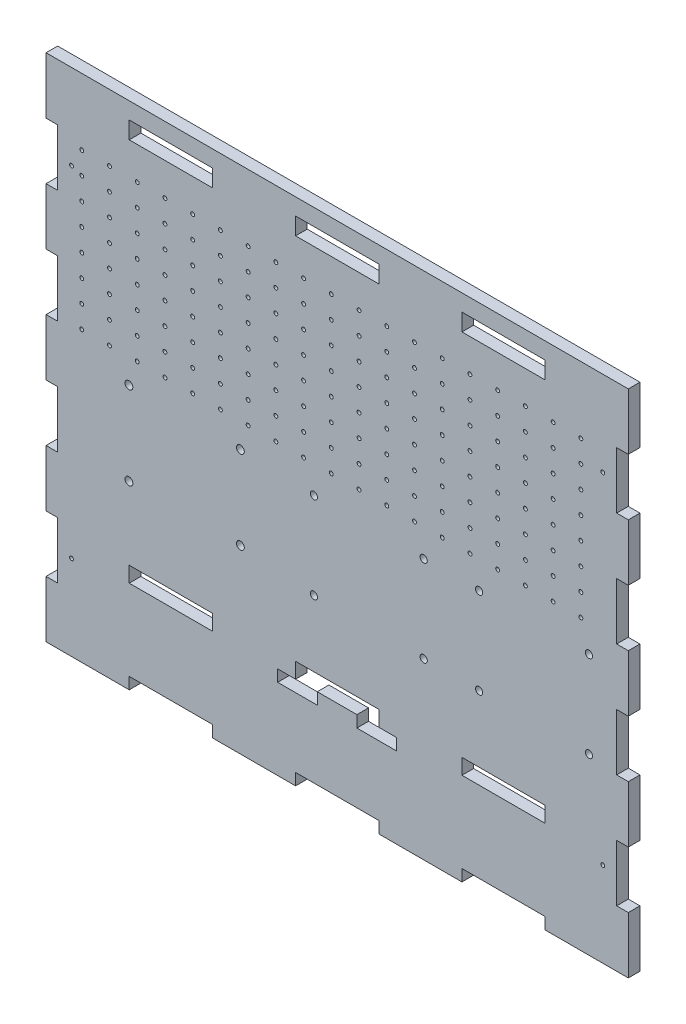
from build123d import *

# Parameters (mm, degrees)
SKETCH1_W                = 266.7
SKETCH1_H                = 223.52
BOSS_EXTRUDE1_DEPTH      = 5.334
SKETCH2_W                = 38.1
SKETCH2_H                = 5.334
CUT_EXTRUDE1_DEPTH       = 197.710659379
SKETCH5_W                = 38.1
SKETCH5_H                = 7.112
CUT_EXTRUDE3_DEPTH       = 197.710659379
SKETCH8_W                = 18.149934459
SKETCH8_H                = 5.334
SKETCH8_W_2              = 18.14993446
CUT_EXTRUDE6_DEPTH       = 197.710659379
SKETCH9_R                = 0.889
CUT_EXTRUDE7_DEPTH       = 197.710659379
SKETCH10_W               = 38.1
SKETCH10_H               = 5.334
BOSS_EXTRUDE2_DEPTH      = 10.16
BOSS_EXTRUDE3_DEPTH      = 76.2
BOSS_EXTRUDE3_DEPTH_BACK = 190.5
SKETCH12_W               = 5.334
SKETCH12_H               = 7.62
SKETCH13_W               = 38.1
SKETCH13_H               = 5.334
BOSS_EXTRUDE4_DEPTH      = 2.54
SKETCH14_W               = 38.1
SKETCH14_H               = 5.334
BOSS_EXTRUDE5_DEPTH      = 2.54
SKETCH15_W               = 38.1
SKETCH15_H               = 5.334
BOSS_EXTRUDE6_DEPTH      = 2.54
SKETCH16_W               = 5.334
SKETCH16_H               = 25.964444445
SKETCH16_H_2             = 25.964444444
CUT_EXTRUDE9_DEPTH       = 205.029793122
SKETCH17_R               = 1.651
CUT_EXTRUDE10_DEPTH      = 205.029793122
SKETCH18_R               = 0.889
CUT_EXTRUDE11_DEPTH      = 205.029793122
SKETCH19_R               = 1.778
CUT_EXTRUDE12_DEPTH      = 205.029793122


with BuildPart() as part:
    # Sketch1 → Boss-Extrude1 (new body)
    with BuildSketch(Plane.XY):
        with Locations((5.474099752, 27.504142138)):
            Rectangle(SKETCH1_W, SKETCH1_H)
    extrude(amount=BOSS_EXTRUDE1_DEPTH)

    # Sketch2 → Cut-Extrude1 (cut, through all)
    with BuildSketch(Plane.XY.offset(5.334)):
        with Locations((-70.725900248, -81.588857862)):
            Rectangle(SKETCH2_W, SKETCH2_H)
        with Locations((5.474099752, -81.588857862)):
            Rectangle(SKETCH2_W, SKETCH2_H)
        with Locations((81.674099752, -81.588857862)):
            Rectangle(SKETCH2_W, SKETCH2_H)
        with Locations((81.674099752, 136.597142138)):
            Rectangle(SKETCH2_W, SKETCH2_H)
        with Locations((5.474099752, 136.597142138)):
            Rectangle(SKETCH2_W, SKETCH2_H)
        with Locations((-70.725900248, 136.597142138)):
            Rectangle(SKETCH2_W, SKETCH2_H)
    extrude(amount=-CUT_EXTRUDE1_DEPTH, mode=Mode.SUBTRACT)

    # Sketch5 → Cut-Extrude3 (cut, through all)
    with BuildSketch(Plane.XY.offset(5.334)):
        with Locations((-70.725900248, -38.378413173)):
            Rectangle(SKETCH5_W, SKETCH5_H)
        with Locations((5.474099752, -38.378413173)):
            Rectangle(SKETCH5_W, SKETCH5_H)
        with Locations((81.674099752, -38.378413173)):
            Rectangle(SKETCH5_W, SKETCH5_H)
    extrude(amount=-CUT_EXTRUDE3_DEPTH, mode=Mode.SUBTRACT)

    # Sketch8 → Cut-Extrude6 (cut, through all)
    with BuildSketch(Plane.XY.offset(5.334)):
        with Locations((-12.722736397, -44.601413173)):
            Rectangle(SKETCH8_W, SKETCH8_H)
        with Locations((23.577132522, -44.601413173)):
            Rectangle(SKETCH8_W_2, SKETCH8_H)
    extrude(amount=-CUT_EXTRUDE6_DEPTH, mode=Mode.SUBTRACT)

    # Sketch9 → Cut-Extrude7 (cut, through all)
    with BuildSketch(Plane.XY.offset(5.334)):
        with Locations((-111.514346632, 118.978930244)):
            Circle(SKETCH9_R)
        with Locations((-98.814346632, 118.978930244)):
            Circle(SKETCH9_R)
        with Locations((-86.114346632, 118.978930244)):
            Circle(SKETCH9_R)
        with Locations((-73.414346632, 118.978930244)):
            Circle(SKETCH9_R)
        with Locations((-60.714346632, 118.978930244)):
            Circle(SKETCH9_R)
        with Locations((-48.014346632, 118.978930244)):
            Circle(SKETCH9_R)
        with Locations((-35.314346632, 118.978930244)):
            Circle(SKETCH9_R)
        with Locations((-22.614346632, 118.978930244)):
            Circle(SKETCH9_R)
        with Locations((-9.914346632, 118.978930244)):
            Circle(SKETCH9_R)
        with Locations((2.785653368, 118.978930244)):
            Circle(SKETCH9_R)
        with Locations((15.485653368, 118.978930244)):
            Circle(SKETCH9_R)
        with Locations((28.185653368, 118.978930244)):
            Circle(SKETCH9_R)
        with Locations((40.885653368, 118.978930244)):
            Circle(SKETCH9_R)
        with Locations((53.585653368, 118.978930244)):
            Circle(SKETCH9_R)
        with Locations((66.285653368, 118.978930244)):
            Circle(SKETCH9_R)
        with Locations((78.985653368, 118.978930244)):
            Circle(SKETCH9_R)
        with Locations((91.685653368, 118.978930244)):
            Circle(SKETCH9_R)
        with Locations((104.385653368, 118.978930244)):
            Circle(SKETCH9_R)
        with Locations((117.085653368, 118.978930244)):
            Circle(SKETCH9_R)
        with Locations((-111.514346632, 108.818930244)):
            Circle(SKETCH9_R)
        with Locations((-98.814346632, 108.818930244)):
            Circle(SKETCH9_R)
        with Locations((-86.114346632, 108.818930244)):
            Circle(SKETCH9_R)
        with Locations((-73.414346632, 108.818930244)):
            Circle(SKETCH9_R)
        with Locations((-60.714346632, 108.818930244)):
            Circle(SKETCH9_R)
        with Locations((-48.014346632, 108.818930244)):
            Circle(SKETCH9_R)
        with Locations((-35.314346632, 108.818930244)):
            Circle(SKETCH9_R)
        with Locations((-22.614346632, 108.818930244)):
            Circle(SKETCH9_R)
        with Locations((-9.914346632, 108.818930244)):
            Circle(SKETCH9_R)
        with Locations((2.785653368, 108.818930244)):
            Circle(SKETCH9_R)
        with Locations((15.485653368, 108.818930244)):
            Circle(SKETCH9_R)
        with Locations((28.185653368, 108.818930244)):
            Circle(SKETCH9_R)
        with Locations((40.885653368, 108.818930244)):
            Circle(SKETCH9_R)
        with Locations((53.585653368, 108.818930244)):
            Circle(SKETCH9_R)
        with Locations((66.285653368, 108.818930244)):
            Circle(SKETCH9_R)
        with Locations((78.985653368, 108.818930244)):
            Circle(SKETCH9_R)
        with Locations((91.685653368, 108.818930244)):
            Circle(SKETCH9_R)
        with Locations((104.385653368, 108.818930244)):
            Circle(SKETCH9_R)
        with Locations((117.085653368, 108.818930244)):
            Circle(SKETCH9_R)
        with Locations((-111.514346632, 98.658930244)):
            Circle(SKETCH9_R)
        with Locations((-98.814346632, 98.658930244)):
            Circle(SKETCH9_R)
        with Locations((-86.114346632, 98.658930244)):
            Circle(SKETCH9_R)
        with Locations((-73.414346632, 98.658930244)):
            Circle(SKETCH9_R)
        with Locations((-60.714346632, 98.658930244)):
            Circle(SKETCH9_R)
        with Locations((-48.014346632, 98.658930244)):
            Circle(SKETCH9_R)
        with Locations((-35.314346632, 98.658930244)):
            Circle(SKETCH9_R)
        with Locations((-22.614346632, 98.658930244)):
            Circle(SKETCH9_R)
        with Locations((-9.914346632, 98.658930244)):
            Circle(SKETCH9_R)
        with Locations((2.785653368, 98.658930244)):
            Circle(SKETCH9_R)
        with Locations((15.485653368, 98.658930244)):
            Circle(SKETCH9_R)
        with Locations((28.185653368, 98.658930244)):
            Circle(SKETCH9_R)
        with Locations((40.885653368, 98.658930244)):
            Circle(SKETCH9_R)
        with Locations((53.585653368, 98.658930244)):
            Circle(SKETCH9_R)
        with Locations((66.285653368, 98.658930244)):
            Circle(SKETCH9_R)
        with Locations((78.985653368, 98.658930244)):
            Circle(SKETCH9_R)
        with Locations((91.685653368, 98.658930244)):
            Circle(SKETCH9_R)
        with Locations((104.385653368, 98.658930244)):
            Circle(SKETCH9_R)
        with Locations((117.085653368, 98.658930244)):
            Circle(SKETCH9_R)
        with Locations((-111.514346632, 88.498930244)):
            Circle(SKETCH9_R)
        with Locations((-98.814346632, 88.498930244)):
            Circle(SKETCH9_R)
        with Locations((-86.114346632, 88.498930244)):
            Circle(SKETCH9_R)
        with Locations((-73.414346632, 88.498930244)):
            Circle(SKETCH9_R)
        with Locations((-60.714346632, 88.498930244)):
            Circle(SKETCH9_R)
        with Locations((-48.014346632, 88.498930244)):
            Circle(SKETCH9_R)
        with Locations((-35.314346632, 88.498930244)):
            Circle(SKETCH9_R)
        with Locations((-22.614346632, 88.498930244)):
            Circle(SKETCH9_R)
        with Locations((-9.914346632, 88.498930244)):
            Circle(SKETCH9_R)
        with Locations((2.785653368, 88.498930244)):
            Circle(SKETCH9_R)
        with Locations((15.485653368, 88.498930244)):
            Circle(SKETCH9_R)
        with Locations((28.185653368, 88.498930244)):
            Circle(SKETCH9_R)
        with Locations((40.885653368, 88.498930244)):
            Circle(SKETCH9_R)
        with Locations((53.585653368, 88.498930244)):
            Circle(SKETCH9_R)
        with Locations((66.285653368, 88.498930244)):
            Circle(SKETCH9_R)
        with Locations((78.985653368, 88.498930244)):
            Circle(SKETCH9_R)
        with Locations((91.685653368, 88.498930244)):
            Circle(SKETCH9_R)
        with Locations((104.385653368, 88.498930244)):
            Circle(SKETCH9_R)
        with Locations((117.085653368, 88.498930244)):
            Circle(SKETCH9_R)
        with Locations((-111.514346632, 78.338930244)):
            Circle(SKETCH9_R)
        with Locations((-98.814346632, 78.338930244)):
            Circle(SKETCH9_R)
        with Locations((-86.114346632, 78.338930244)):
            Circle(SKETCH9_R)
        with Locations((-73.414346632, 78.338930244)):
            Circle(SKETCH9_R)
        with Locations((-60.714346632, 78.338930244)):
            Circle(SKETCH9_R)
        with Locations((-48.014346632, 78.338930244)):
            Circle(SKETCH9_R)
        with Locations((-35.314346632, 78.338930244)):
            Circle(SKETCH9_R)
        with Locations((-22.614346632, 78.338930244)):
            Circle(SKETCH9_R)
        with Locations((-9.914346632, 78.338930244)):
            Circle(SKETCH9_R)
        with Locations((2.785653368, 78.338930244)):
            Circle(SKETCH9_R)
        with Locations((15.485653368, 78.338930244)):
            Circle(SKETCH9_R)
        with Locations((28.185653368, 78.338930244)):
            Circle(SKETCH9_R)
        with Locations((40.885653368, 78.338930244)):
            Circle(SKETCH9_R)
        with Locations((53.585653368, 78.338930244)):
            Circle(SKETCH9_R)
        with Locations((66.285653368, 78.338930244)):
            Circle(SKETCH9_R)
        with Locations((78.985653368, 78.338930244)):
            Circle(SKETCH9_R)
        with Locations((91.685653368, 78.338930244)):
            Circle(SKETCH9_R)
        with Locations((104.385653368, 78.338930244)):
            Circle(SKETCH9_R)
        with Locations((117.085653368, 78.338930244)):
            Circle(SKETCH9_R)
        with Locations((-111.514346632, 68.178930244)):
            Circle(SKETCH9_R)
        with Locations((-98.814346632, 68.178930244)):
            Circle(SKETCH9_R)
        with Locations((-86.114346632, 68.178930244)):
            Circle(SKETCH9_R)
        with Locations((-73.414346632, 68.178930244)):
            Circle(SKETCH9_R)
        with Locations((-60.714346632, 68.178930244)):
            Circle(SKETCH9_R)
        with Locations((-48.014346632, 68.178930244)):
            Circle(SKETCH9_R)
        with Locations((-35.314346632, 68.178930244)):
            Circle(SKETCH9_R)
        with Locations((-22.614346632, 68.178930244)):
            Circle(SKETCH9_R)
        with Locations((-9.914346632, 68.178930244)):
            Circle(SKETCH9_R)
        with Locations((2.785653368, 68.178930244)):
            Circle(SKETCH9_R)
        with Locations((15.485653368, 68.178930244)):
            Circle(SKETCH9_R)
        with Locations((28.185653368, 68.178930244)):
            Circle(SKETCH9_R)
        with Locations((40.885653368, 68.178930244)):
            Circle(SKETCH9_R)
        with Locations((53.585653368, 68.178930244)):
            Circle(SKETCH9_R)
        with Locations((66.285653368, 68.178930244)):
            Circle(SKETCH9_R)
        with Locations((78.985653368, 68.178930244)):
            Circle(SKETCH9_R)
        with Locations((91.685653368, 68.178930244)):
            Circle(SKETCH9_R)
        with Locations((104.385653368, 68.178930244)):
            Circle(SKETCH9_R)
        with Locations((117.085653368, 68.178930244)):
            Circle(SKETCH9_R)
        with Locations((-111.514346632, 58.018930244)):
            Circle(SKETCH9_R)
        with Locations((-98.814346632, 58.018930244)):
            Circle(SKETCH9_R)
        with Locations((-86.114346632, 58.018930244)):
            Circle(SKETCH9_R)
        with Locations((-73.414346632, 58.018930244)):
            Circle(SKETCH9_R)
        with Locations((-60.714346632, 58.018930244)):
            Circle(SKETCH9_R)
        with Locations((-48.014346632, 58.018930244)):
            Circle(SKETCH9_R)
        with Locations((-35.314346632, 58.018930244)):
            Circle(SKETCH9_R)
        with Locations((-22.614346632, 58.018930244)):
            Circle(SKETCH9_R)
        with Locations((-9.914346632, 58.018930244)):
            Circle(SKETCH9_R)
        with Locations((2.785653368, 58.018930244)):
            Circle(SKETCH9_R)
        with Locations((15.485653368, 58.018930244)):
            Circle(SKETCH9_R)
        with Locations((28.185653368, 58.018930244)):
            Circle(SKETCH9_R)
        with Locations((40.885653368, 58.018930244)):
            Circle(SKETCH9_R)
        with Locations((53.585653368, 58.018930244)):
            Circle(SKETCH9_R)
        with Locations((66.285653368, 58.018930244)):
            Circle(SKETCH9_R)
        with Locations((78.985653368, 58.018930244)):
            Circle(SKETCH9_R)
        with Locations((91.685653368, 58.018930244)):
            Circle(SKETCH9_R)
        with Locations((104.385653368, 58.018930244)):
            Circle(SKETCH9_R)
        with Locations((117.085653368, 58.018930244)):
            Circle(SKETCH9_R)
        with Locations((-111.514346632, 47.858930244)):
            Circle(SKETCH9_R)
        with Locations((-98.814346632, 47.858930244)):
            Circle(SKETCH9_R)
        with Locations((-86.114346632, 47.858930244)):
            Circle(SKETCH9_R)
        with Locations((-73.414346632, 47.858930244)):
            Circle(SKETCH9_R)
        with Locations((-60.714346632, 47.858930244)):
            Circle(SKETCH9_R)
        with Locations((-48.014346632, 47.858930244)):
            Circle(SKETCH9_R)
        with Locations((-35.314346632, 47.858930244)):
            Circle(SKETCH9_R)
        with Locations((-22.614346632, 47.858930244)):
            Circle(SKETCH9_R)
        with Locations((-9.914346632, 47.858930244)):
            Circle(SKETCH9_R)
        with Locations((2.785653368, 47.858930244)):
            Circle(SKETCH9_R)
        with Locations((15.485653368, 47.858930244)):
            Circle(SKETCH9_R)
        with Locations((28.185653368, 47.858930244)):
            Circle(SKETCH9_R)
        with Locations((40.885653368, 47.858930244)):
            Circle(SKETCH9_R)
        with Locations((53.585653368, 47.858930244)):
            Circle(SKETCH9_R)
        with Locations((66.285653368, 47.858930244)):
            Circle(SKETCH9_R)
        with Locations((78.985653368, 47.858930244)):
            Circle(SKETCH9_R)
        with Locations((91.685653368, 47.858930244)):
            Circle(SKETCH9_R)
        with Locations((104.385653368, 47.858930244)):
            Circle(SKETCH9_R)
        with Locations((117.085653368, 47.858930244)):
            Circle(SKETCH9_R)
    extrude(amount=-CUT_EXTRUDE7_DEPTH, mode=Mode.SUBTRACT)

    # Sketch10 → Boss-Extrude2 (add)
    with BuildSketch(Plane(origin=(0, 139.264142138, 0), x_dir=(1, 0, 0), z_dir=(0, 1, 0))):
        with Locations((-32.625900248, -2.667)):
            Rectangle(SKETCH10_W, SKETCH10_H)
    extrude(amount=BOSS_EXTRUDE2_DEPTH)

    # Sketch12 → Boss-Extrude3 (add, two sides: drawn at the far end of the back side and taken through both)
    with BuildSketch(Plane.ZY.offset(51.675900248).offset(-BOSS_EXTRUDE3_DEPTH_BACK)):
        with Locations((2.667, 145.614142138)):
            Rectangle(SKETCH12_W, SKETCH12_H)
    extrude(amount=BOSS_EXTRUDE3_DEPTH + BOSS_EXTRUDE3_DEPTH_BACK)

    # Sketch13 → Boss-Extrude4 (add)
    with BuildSketch(Plane(origin=(0, 139.264142138, 0), x_dir=(1, 0, 0), z_dir=(0, 1, 0))):
        with Locations((-108.825900248, -2.667)):
            Rectangle(SKETCH13_W, SKETCH13_H)
    extrude(amount=BOSS_EXTRUDE4_DEPTH)

    # Sketch14 → Boss-Extrude5 (add)
    with BuildSketch(Plane(origin=(0, 139.264142138, 0), x_dir=(1, 0, 0), z_dir=(0, 1, 0))):
        with Locations((43.574099752, -2.667)):
            Rectangle(SKETCH14_W, SKETCH14_H)
    extrude(amount=BOSS_EXTRUDE5_DEPTH)

    # Sketch15 → Boss-Extrude6 (add)
    with BuildSketch(Plane(origin=(0, 139.264142138, 0), x_dir=(1, 0, 0), z_dir=(0, 1, 0))):
        with Locations((119.774099752, -2.667)):
            Rectangle(SKETCH15_W, SKETCH15_H)
    extrude(amount=BOSS_EXTRUDE6_DEPTH)

    # Sketch16 → Cut-Extrude9 (cut, through all)
    with BuildSketch(Plane.XY.offset(5.334)):
        with Locations((-125.208900248, -45.309191196)):
            Rectangle(SKETCH16_W, SKETCH16_H)
        with Locations((-125.208900248, 6.619697693)):
            Rectangle(SKETCH16_W, SKETCH16_H)
        with Locations((-125.208900248, 58.548586582)):
            Rectangle(SKETCH16_W, SKETCH16_H_2)
        with Locations((-125.208900248, 110.477475471)):
            Rectangle(SKETCH16_W, SKETCH16_H_2)
        with Locations((136.157099752, 110.477475471)):
            Rectangle(SKETCH16_W, SKETCH16_H_2)
        with Locations((136.157099752, 58.548586582)):
            Rectangle(SKETCH16_W, SKETCH16_H_2)
        with Locations((136.157099752, 6.619697693)):
            Rectangle(SKETCH16_W, SKETCH16_H)
        with Locations((136.157099752, -45.309191196)):
            Rectangle(SKETCH16_W, SKETCH16_H)
    extrude(amount=-CUT_EXTRUDE9_DEPTH, mode=Mode.SUBTRACT)

    # Sketch17 → Cut-Extrude10 (cut, through all)
    with BuildSketch(Plane.XY.offset(5.334)):
        with Locations((120.790099752, 35.158930244)):
            Circle(SKETCH17_R)
        with Locations((70.498099752, 35.158930244)):
            Circle(SKETCH17_R)
        with Locations((70.498099752, -4.465069756)):
            Circle(SKETCH17_R)
        with Locations((120.790099752, -4.465069756)):
            Circle(SKETCH17_R)
        with Locations((45.098099752, 35.158930244)):
            Circle(SKETCH17_R)
        with Locations((-5.193900248, 35.158930244)):
            Circle(SKETCH17_R)
        with Locations((-5.193900248, -4.465069756)):
            Circle(SKETCH17_R)
        with Locations((45.098099752, -4.465069756)):
            Circle(SKETCH17_R)
    extrude(amount=-CUT_EXTRUDE10_DEPTH, mode=Mode.SUBTRACT)

    # Sketch18 → Cut-Extrude11 (cut, through all)
    with BuildSketch(Plane.XY.offset(5.334)):
        with Locations((127.140099752, 110.477475471)):
            Circle(SKETCH18_R)
        with Locations((-116.191900248, 110.477475471)):
            Circle(SKETCH18_R)
        with Locations((-116.191900248, -45.309191196)):
            Circle(SKETCH18_R)
        with Locations((127.140099752, -45.309191196)):
            Circle(SKETCH18_R)
    extrude(amount=-CUT_EXTRUDE11_DEPTH, mode=Mode.SUBTRACT)

    # Sketch19 → Cut-Extrude12 (cut, through all)
    with BuildSketch(Plane(origin=(0, 0, 0), x_dir=(-1, 0, 0), z_dir=(0, 0, -1))):
        with Locations((89.902900248, 36.555930244)):
            Circle(SKETCH19_R)
        with Locations((89.902900248, -1.544069756)):
            Circle(SKETCH19_R)
        with Locations((38.848900248, -1.544069756)):
            Circle(SKETCH19_R)
        with Locations((38.848900248, 36.555930244)):
            Circle(SKETCH19_R)
    extrude(amount=-CUT_EXTRUDE12_DEPTH, mode=Mode.SUBTRACT)


solid = part.part
